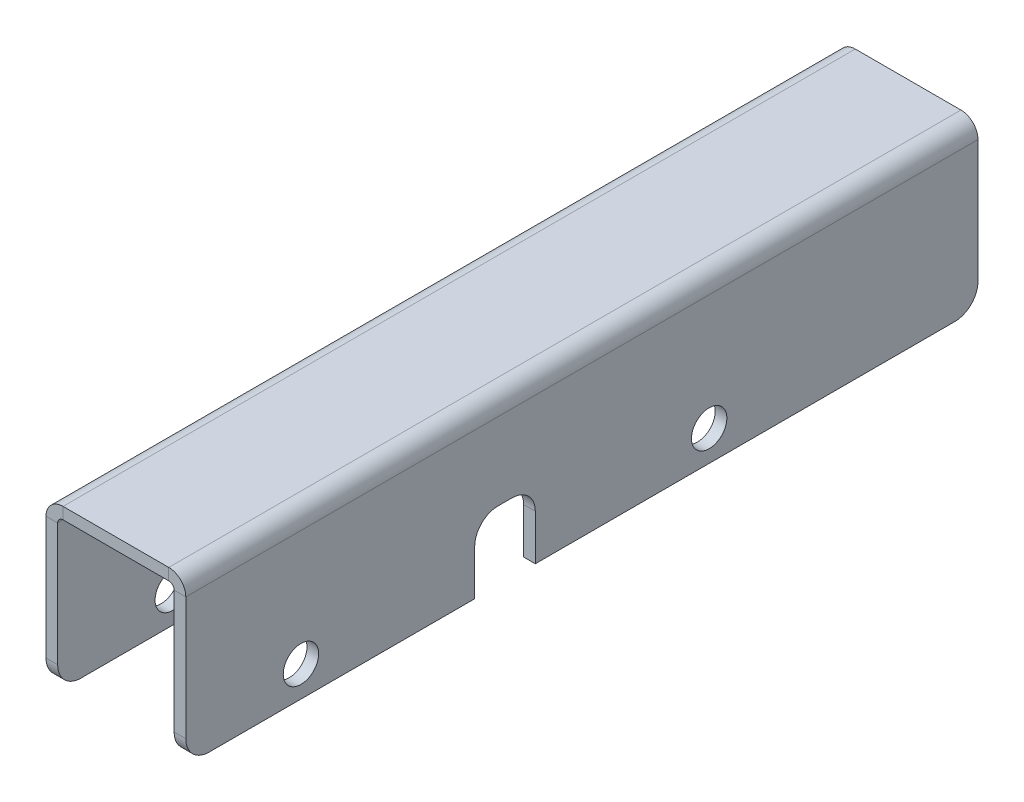
from build123d import *

# Parameters (mm, degrees)
BASE_FLANGE1_DEPTH           = 1.5875
EDGE_FLANGE1_STRIP_W         = 7.8232
EDGE_FLANGE1_STRIP_H         = 1.5875
EDGE_FLANGE1_STRIP_CUT_DEPTH = 107.95
EDGE_FLANGE1_DEPTH           = 107.95
EDGE_FLANGE2_STRIP_W         = 7.8232
EDGE_FLANGE2_STRIP_H         = 1.5875
EDGE_FLANGE2_STRIP_CUT_DEPTH = 107.95
EDGE_FLANGE2_DEPTH           = 107.95
HOLE1_START                  = -1.5875
HOLE1_OUTLINE_R              = 2.413
HOLE1_DEPTH                  = 19.05
CUT_EXTRUDE1_DEPTH           = 103.402979235
CUT_EXTRUDE1_DEPTH_BACK      = 103.402979235
SKETCH27_W                   = 8.255
SKETCH27_H                   = 9.364783331
FILLET1_R                    = 3.175


# Read off the part's stored shape, not the designer's step: Hole1
# Sheet-metal steps are written as plain solids
with BuildPart() as part:
    # Sketch1 → Base-Flange1 (new body)
    with BuildSketch(Plane(origin=(0, 0, 0), x_dir=(0, 0, -1), z_dir=(1, 0, 0))):
        Polygon((0, 0), (88.9, 0), (98.425, 0), (98.425, 22.225), (88.9, 22.225), (0, 22.225), (-9.525, 22.225), (-9.525, 0), align=None)
    extrude(amount=-BASE_FLANGE1_DEPTH)

    # Edge-Flange1 strip (across the edge) → Edge-Flange1 strip cut (cut)
    with BuildSketch(Plane(origin=(0, 22.225, -98.425), x_dir=(0, -1, 0), z_dir=(0, 0, 1))):
        with Locations((-1.5875, -0.79375)):
            Rectangle(EDGE_FLANGE1_STRIP_W, EDGE_FLANGE1_STRIP_H)
    extrude(amount=EDGE_FLANGE1_STRIP_CUT_DEPTH, mode=Mode.SUBTRACT)

    # Edge-Flange1 section (across the edge) → Edge-Flange1 (add)
    with BuildSketch(Plane(origin=(0, 22.225, -98.425), x_dir=(0, -1, 0), z_dir=(0, 0, 1))):
        with BuildLine():
            Line((0, 0.7366), (0, 17.4625))
            Line((0, 17.4625), (1.5875, 17.4625))
            Line((1.5875, 17.4625), (1.5875, 0.7366))
            ThreePointArc((1.5875, 0.7366), (1.803245145, 0.215745145), (2.3241, 0))
            Line((2.3241, 0), (2.3241, -1.5875))
            ThreePointArc((2.3241, -1.5875), (0.68071313, -0.90678687), (0, 0.7366))
        make_face()
    extrude(amount=EDGE_FLANGE1_DEPTH)

    # Edge-Flange2 strip (across the edge) → Edge-Flange2 strip cut (cut)
    with BuildSketch(Plane(origin=(17.4625, 20.6375, -98.425), x_dir=(-1, 0, 0), z_dir=(0, 0, 1))):
        with Locations((-1.5875, -0.79375)):
            Rectangle(EDGE_FLANGE2_STRIP_W, EDGE_FLANGE2_STRIP_H)
    extrude(amount=EDGE_FLANGE2_STRIP_CUT_DEPTH, mode=Mode.SUBTRACT)

    # Edge-Flange2 section (across the edge) → Edge-Flange2 (add)
    with BuildSketch(Plane(origin=(17.4625, 20.6375, -98.425), x_dir=(-1, 0, 0), z_dir=(0, 0, 1))):
        with BuildLine():
            Line((0, 0.7366), (0, 20.6375))
            Line((0, 20.6375), (1.5875, 20.6375))
            Line((1.5875, 20.6375), (1.5875, 0.7366))
            ThreePointArc((1.5875, 0.7366), (1.803245145, 0.215745145), (2.3241, 0))
            Line((2.3241, 0), (2.3241, -1.5875))
            ThreePointArc((2.3241, -1.5875), (0.68071313, -0.90678687), (0, 0.7366))
        make_face()
    extrude(amount=EDGE_FLANGE2_DEPTH)

    # Hole1 outline → Hole1 (cut)
    with BuildSketch(Plane.YZ.offset(HOLE1_START)):
        with Locations((4.148353843, -61.790618702)):
            Circle(HOLE1_OUTLINE_R)
        with Locations((4.148353843, -6.164618702)):
            Circle(HOLE1_OUTLINE_R)
    extrude(amount=HOLE1_DEPTH, mode=Mode.SUBTRACT)

    # Sketch27 → Cut-Extrude1 (cut, two sides: drawn at the far end of the back side and taken through both)
    with BuildSketch(Plane(origin=(0, 0, 0), x_dir=(0, 0, -1), z_dir=(1, 0, 0)).offset(-CUT_EXTRUDE1_DEPTH_BACK)):
        with Locations((33.9725, 4.682391665)):
            Rectangle(SKETCH27_W, SKETCH27_H)
    extrude(amount=CUT_EXTRUDE1_DEPTH + CUT_EXTRUDE1_DEPTH_BACK, mode=Mode.SUBTRACT)

    # Fillet1
    fillet1_edges = [part.edges().sort_by_distance(p)[0] for p in [
        (-0.79375, 9.364783331, -29.845),
        (-0.79375, 9.364783331, -38.1),
        (16.66875, 9.364783331, -29.845),
        (16.66875, 9.364783331, -38.1),
        (-0.79375, 0, 9.525),
        (-0.79375, 0, -98.425),
        (16.66875, 0, -98.425),
        (16.66875, 0, 9.525),
    ]]
    fillet(fillet1_edges, radius=FILLET1_R)


solid = part.part
